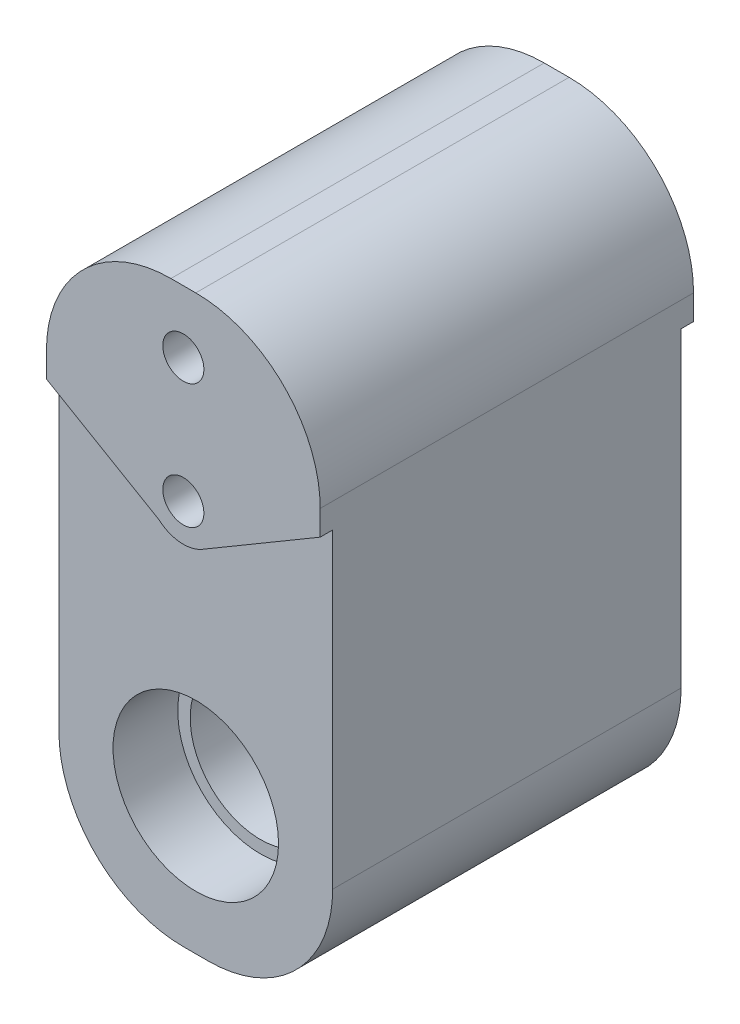
from build123d import *
from build123d.topology import SkipClean

# Parameters (mm, degrees)
EXTRUDE_459_DEPTH      = 14
EXTRUDE_459_DEPTH_BACK = 14
SKETCH_1_W             = 22
SKETCH_1_H             = 47
SKETCH_2_R             = 6.65
CUT_EXTRUDE_603_DEPTH  = 5.2
SKETCH_4_R             = 5.65
CUT_EXTRUDE_734_DEPTH  = 45.009544419
SKETCH_5_R             = 1.65
CUT_EXTRUDE_990_DEPTH  = 47.914816423
SKETCH_9_R             = 1.65
EXTRUDE_1331_DEPTH     = 1
FILLET_1_R             = 10


with BuildPart() as part:
    # Эскиз1 → Extrude 459 (new, two sides: drawn at the far end of the back side and taken through both)
    with BuildSketch(Plane.XY.offset(-EXTRUDE_459_DEPTH_BACK)):
        with Locations((0, 12.5)):
            Rectangle(SKETCH_1_W, SKETCH_1_H)
    extrude(amount=EXTRUDE_459_DEPTH + EXTRUDE_459_DEPTH_BACK)

    # Эскиз2 → Cut-Extrude 603 (cut)
    with BuildSketch(Plane.XY.offset(14)):
        Circle(SKETCH_2_R)
    cut_extrude_603 = extrude(amount=-CUT_EXTRUDE_603_DEPTH, mode=Mode.SUBTRACT)

    # Эскиз4 → Cut-Extrude 734 (cut, through all)
    with BuildSketch(Plane.XY.offset(8.8)):
        Circle(SKETCH_4_R)
    extrude(amount=-CUT_EXTRUDE_734_DEPTH, mode=Mode.SUBTRACT)

    # Зеркальное отражение2: Cut-Extrude 603 across plane
    add(cut_extrude_603.mirror(Plane.XY), mode=Mode.SUBTRACT)

    # Эскиз5 → Cut-Extrude 990 (cut, through all)
    with BuildSketch(Plane(origin=(0, 0, -14), x_dir=(-1, 0, 0), z_dir=(0, 0, -1))):
        with Locations((0, 31)):
            Circle(SKETCH_5_R)
        with Locations((0, 21)):
            Circle(SKETCH_5_R)
    extrude(amount=-CUT_EXTRUDE_990_DEPTH, mode=Mode.SUBTRACT)

    # Эскиз9 → Extrude 1331 (add)
    with SkipClean():  # the faces are left unmerged after this step: merging them gives an invalid solid
        with BuildSketch(Plane.XY.offset(14)):
            with BuildLine():
                Line((-11, 36), (-11, 24))
                Line((-11, 24), (-1.994778095, 18.759272361))
                ThreePointArc((-1.994778095, 18.759272361), (-0.291873593, 18.014232125), (1.523076923, 18.415384615))
                Line((1.523076923, 18.415384615), (11, 24))
                Line((11, 24), (11, 36))
                Line((11, 36), (-11, 36))
            make_face()
            with Locations((0, 21)):
                Circle(SKETCH_9_R, mode=Mode.SUBTRACT)
            with Locations((0, 31)):
                Circle(SKETCH_9_R, mode=Mode.SUBTRACT)
        extrude_1331 = extrude(amount=EXTRUDE_1331_DEPTH)

    # Зеркальное отражение1: Extrude 1331 across plane
    with SkipClean():  # the faces are left unmerged after this step: merging them gives an invalid solid
        add(extrude_1331.mirror(Plane.XY))

    # Скругление1
    fillet_1_edges = [part.edges().sort_by_distance(p)[0] for p in [
        (11, -11, 0),
        (-11, -11, 0),
        (-11, 36, 0),
        (11, 36, 0),
    ]]
    fillet(fillet_1_edges, radius=FILLET_1_R)


solid = part.part
